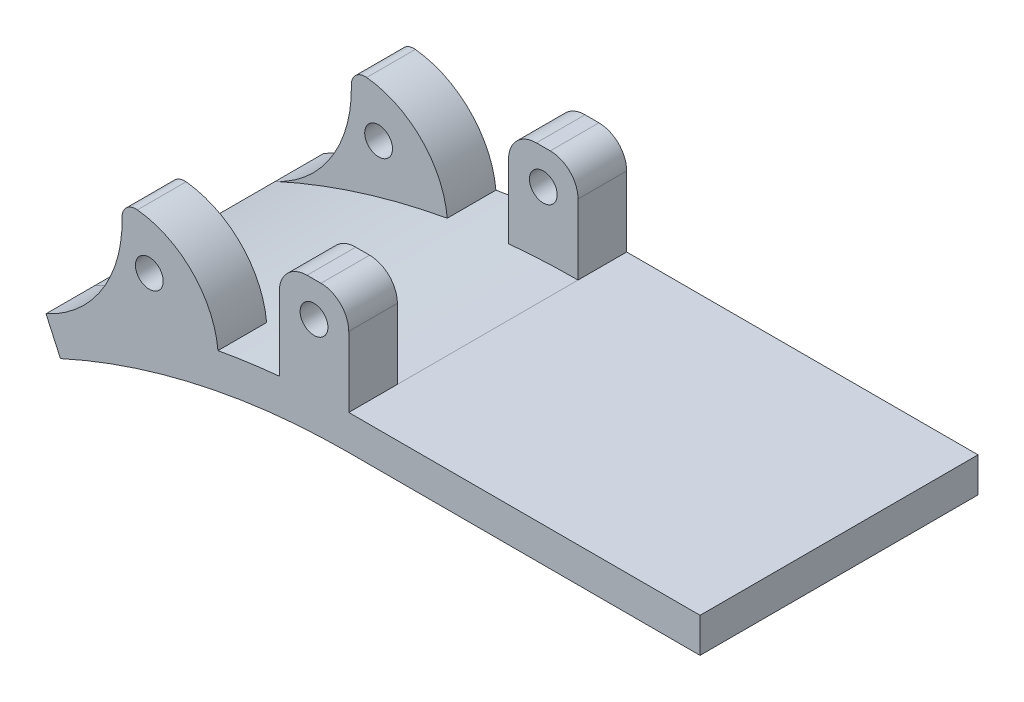
from build123d import *

# Parameters (mm, degrees)
BOSS_EXTRUDE1_DEPTH     = 38
BOSS_EXTRUDE2_START     = 1
BOSS_EXTRUDE2_DEPTH     = 1
SKETCH5_R               = 1.5
BOSS_EXTRUDE4_DEPTH     = 2
CUT_EXTRUDE1_REACH      = 109.923
CUT_EXTRUDE1_END_RADIUS = 5
SKETCH6_W               = 4
SKETCH6_H               = 25
SKETCH7_W               = 12
SKETCH7_H               = 7
CUT_EXTRUDE2_DEPTH      = 4.870537
SKETCH8_W               = 14
SKETCH8_H               = 8
SKETCH8_W_2             = 7
SKETCH8_H_2             = 2
BOSS_EXTRUDE5_DEPTH     = 1
CUT_EXTRUDE3_REACH      = 112.064
BOSS_EXTRUDE6_REACH     = 114.27
FILLET1_R               = 2
FILLET2_R               = 1.5
CUT_EXTRUDE4_START      = -1
CUT_EXTRUDE4_DEPTH      = 1
CUT_EXTRUDE5_DEPTH      = 114.605044241
CUT_EXTRUDE5_DEPTH_BACK = 114.605044241
CUT_EXTRUDE6_DEPTH      = 1
BOSS_EXTRUDE7_DEPTH     = 40
CUT_EXTRUDE7_DEPTH      = 114.952209619
BOSS_EXTRUDE8_START     = -7
SKETCH16_R              = 2
BOSS_EXTRUDE8_DEPTH     = 7
SKETCH17_R              = 2
BOSS_EXTRUDE9_DEPTH     = 7
SKETCH18_R              = 2
BOSS_EXTRUDE10_DEPTH    = 7
BOSS_EXTRUDE11_START    = -7
SKETCH19_R              = 2
BOSS_EXTRUDE11_DEPTH    = 7


with BuildPart() as part:
    # Sketch1 → Boss-Extrude1 (new body)
    with BuildSketch(Plane.XY):
        with BuildLine():
            ThreePointArc((94.07424068, -40.969403892), (98.52214239, -30.71978446), (94.053011164, -20.479403892))
            Line((94.053011164, -20.479403892), (42.671612541, -20.479403892))
            ThreePointArc((42.671612541, -20.479403892), (21.438645912, -22.763779795), (1.177500664, -29.512352859))
            ThreePointArc((1.177500664, -29.512352859), (-2.191079084, -36.245666757), (3.671612541, -40.969403889))
            Line((3.671612541, -40.969403889), (3.671612541, -39.969403889))
            ThreePointArc((3.671612541, -39.969403889), (-1.213963813, -36.032956279), (1.593185977, -30.421861364))
            ThreePointArc((1.593185977, -30.421861364), (21.65135639, -23.740895066), (42.671612541, -21.479403892))
            Line((42.671612541, -21.479403892), (93.651612541, -21.479403892))
            ThreePointArc((93.651612541, -21.479403892), (97.522142299, -30.720228087), (93.671612541, -39.969403889))
            Line((93.671612541, -39.969403889), (93.671612541, -40.969403892))
            Line((93.671612541, -40.969403892), (94.07424068, -40.969403892))
        make_face()
    extrude(amount=BOSS_EXTRUDE1_DEPTH)

    # Sketch2 → Boss-Extrude2 (add)
    with BuildSketch(Plane(origin=(0, 0, 0), x_dir=(-1, 0, 0), z_dir=(0, 0, -1)).offset(BOSS_EXTRUDE2_START)):
        with BuildLine():
            Line((-93.671612541, -40.969403892), (-3.671612541, -40.969403889))
            ThreePointArc((-3.671612541, -40.969403889), (2.191079084, -36.245666757), (-1.177500664, -29.512352859))
            ThreePointArc((-1.177500664, -29.512352859), (-21.438645912, -22.763779795), (-42.671612541, -20.479403892))
            Line((-42.671612541, -20.479403892), (-94.053011164, -20.479403892))
            ThreePointArc((-94.053011164, -20.479403892), (-98.52214239, -30.71978446), (-94.07424068, -40.969403892))
            Line((-94.07424068, -40.969403892), (-93.671612541, -40.969403892))
        make_face()
    boss_extrude2 = extrude(amount=-BOSS_EXTRUDE2_DEPTH)

    # Mirror1: Boss-Extrude2 across plane
    add(boss_extrude2.mirror(Plane.XY.offset(19)))

    # Sketch5 → Boss-Extrude4 (add)
    with BuildSketch(Plane.XZ.offset(21.479403892)):
        with Locations(Location((45.301612541, 27.89, 0), (0, 0, 270))):
            Circle(SKETCH5_R)
        with Locations(Location((45.301612541, 10.11, 0), (0, 0, 270))):
            Circle(SKETCH5_R)
        with Locations(Location((91.021612541, 27.89, 0), (0, 0, 270))):
            Circle(SKETCH5_R)
        with Locations(Location((91.021612541, 10.11, 0), (0, 0, 270))):
            Circle(SKETCH5_R)
    extrude(amount=BOSS_EXTRUDE4_DEPTH)

    # Cut-Extrude1: up to this cylinder (the profile starts outside it)
    cut_extrude1_end = Plane(origin=(3.671612541, -34.969403889, 19), z_dir=(0, 0, -1)) * Cylinder(CUT_EXTRUDE1_END_RADIUS, 230.846, mode=Mode.PRIVATE)
    # Sketch6 → Cut-Extrude1 (cut, up to the surface)
    with BuildSketch(Plane(origin=(0.000112733, -40.969403891, 0), x_dir=(1, 0, 0), z_dir=(0, -1, 0)), mode=Mode.PRIVATE) as cut_extrude1_sk1:
        with Locations((1.671499809, 19)):
            Rectangle(SKETCH6_W, SKETCH6_H)
    cut_extrude1_tool1 = extrude(cut_extrude1_sk1.sketch, amount=-CUT_EXTRUDE1_REACH, mode=Mode.PRIVATE) - cut_extrude1_end
    add(cut_extrude1_tool1.solids().sort_by_distance((1.671613, -40.969404, 19))[0], mode=Mode.SUBTRACT)

    # Sketch7 → Cut-Extrude2 (cut)
    with BuildSketch(Plane(origin=(98.522149904, 0, 0), x_dir=(0, 0, -1), z_dir=(1, 0, 0))):
        with Locations((-19, -23.979403892)):
            Rectangle(SKETCH7_W, SKETCH7_H)
    extrude(amount=-CUT_EXTRUDE2_DEPTH, mode=Mode.SUBTRACT)

    # Sketch8 → Boss-Extrude5 (add)
    with BuildSketch(Plane(origin=(93.651612541, 0, 0), x_dir=(0, 0, -1), z_dir=(1, 0, 0))):
        with Locations((-19, -24.479403892)):
            Rectangle(SKETCH8_W, SKETCH8_H)
        with Locations((-19, -24.179403892)):
            Rectangle(SKETCH8_W_2, SKETCH8_H_2, mode=Mode.SUBTRACT)
    extrude(amount=BOSS_EXTRUDE5_DEPTH)

    # Sketch9 → Cut-Extrude3 (cut, up to next)
    with BuildSketch(Plane.XY.offset(26), mode=Mode.PRIVATE) as cut_extrude3_sk1:
        with BuildLine():
            Line((94.651612541, -21.070233304), (94.651612541, -20.479403892))
            Line((94.651612541, -20.479403892), (94.053011164, -20.479403892))
            ThreePointArc((94.053011164, -20.479403892), (94.356749733, -20.770322341), (94.651612541, -21.070233304))
        make_face()
    cut_extrude3_tool1 = extrude(cut_extrude3_sk1.sketch, amount=-CUT_EXTRUDE3_REACH, mode=Mode.PRIVATE) & part.part
    add(cut_extrude3_tool1.solids().sort_by_distance((94.454082, -20.674371, 26))[0], mode=Mode.SUBTRACT)

    # Sketch10 → Boss-Extrude6 (add, up to next)
    with BuildSketch(Plane(origin=(94.651612541, 0, 0), x_dir=(0, 0, -1), z_dir=(1, 0, 0)), mode=Mode.PRIVATE) as boss_extrude6_sk1:
        Polygon((-26, -22.586039205), (-26, -28.479403892), (-12, -28.479403892), (-12, -22.586039205), (-13, -22.586039205), (-13, -27.479403892), (-25, -27.479403892), (-25, -22.586039205), align=None)
    boss_extrude6_tool1 = extrude(boss_extrude6_sk1.sketch, amount=BOSS_EXTRUDE6_REACH, mode=Mode.PRIVATE) - part.part
    add(boss_extrude6_tool1.solids().sort_by_distance((94.651613, -25.532722, 25.848101))[0])

    # Fillet1
    # the kernel refuses this fillet: 2 mm, written as the material it takes off along each edge
    with BuildSketch(Plane(origin=(94.053011164, -20.479403892, -3.217701096), x_dir=(-1, 0, 0), z_dir=(0, 0, 1))) as fillet1_piece_1:
        with BuildLine():
            CenterArc((0.8212769, 2), FILLET1_R, 223.46466941, 46.53533059)
            ThreePointArc((-0.630320494, 0.624185693), (-0.320105264, 0.307099227), (0, 0))
            Line((0, 0), (0.8212769, 0))
        make_face()
    extrude(amount=44.435402191, mode=Mode.SUBTRACT)

    # Fillet2
    # the kernel refuses this fillet: 1.5 mm, written as the material it takes off along each edge
    with BuildSketch(Plane(origin=(93.651612541, -28.479403892, 8.25), x_dir=(1, 0, 0), z_dir=(0, 0, 1))) as fillet2_piece_1:
        with BuildLine():
            CenterArc((FILLET2_R, FILLET2_R), FILLET2_R, 180, 90)
            Line((0, FILLET2_R), (0, 0))
            Line((0, 0), (FILLET2_R, 0))
        make_face()
    extrude(amount=21.5, mode=Mode.SUBTRACT)
    with BuildSketch(Plane(origin=(94.651612541, -21.070877825, 25), x_dir=(-0.9302888810599873, 0.3668277494630918, 0), z_dir=(0, 0, -1))) as fillet2_piece_2:
        with BuildLine():
            CenterArc((1.062160749, -1.395433322), FILLET2_R, 68.479891106, 90)
            Line((-0.333272572, -0.845191697), (-0.472815904, -0.790167535))
            Line((-0.472815904, -0.790167535), (-0.139543332, 0.055024162))
            Line((-0.139543332, 0.055024162), (-0.060315789, 0.137339017))
            ThreePointArc((-0.060315789, 0.137339017), (1.592890188, 0.168934204), (1.667426536, 0.139543332))
            Line((1.667426536, 0.139543332), (1.612402374, 0))
        make_face()
    extrude(amount=12, mode=Mode.SUBTRACT)

    # Sketch11 → Cut-Extrude4 (cut)
    with BuildSketch(Plane.XY.offset(39).offset(CUT_EXTRUDE4_START)):
        with BuildLine():
            Line((94.07424068, -40.969403892), (94.07424068, -27.479403892))
            Line((94.07424068, -27.479403892), (42.671612541, -27.479403892))
            ThreePointArc((42.671612541, -27.479403892), (20.062639565, -30.27500623), (-1.184449421, -38.493416121))
            ThreePointArc((-1.184449421, -38.493416121), (0.946183529, -40.314685612), (3.671612541, -40.969403889))
            Line((3.671612541, -40.969403889), (94.07424068, -40.969403892))
        make_face()
    extrude(amount=CUT_EXTRUDE4_DEPTH, mode=Mode.SUBTRACT)

    # Sketch12 → Cut-Extrude5 (cut, two sides: drawn at the far end of the back side and taken through both)
    with BuildSketch(Plane.XY.offset(38).offset(-CUT_EXTRUDE5_DEPTH_BACK)):
        with BuildLine():
            Line((0.671612541, -40.165556311), (0.671612541, -38.969403889))
            ThreePointArc((0.671612541, -38.969403889), (2.090473711, -39.712820379), (3.671612541, -39.969403889))
            Line((3.671612541, -39.969403889), (3.671612541, -40.969403889))
            ThreePointArc((3.671612541, -40.969403889), (2.118698271, -40.764958846), (0.671612541, -40.165556311))
        make_face()
    extrude(amount=CUT_EXTRUDE5_DEPTH + CUT_EXTRUDE5_DEPTH_BACK, mode=Mode.SUBTRACT)

    # Sketch13 → Cut-Extrude6 (cut)
    with BuildSketch(Plane(origin=(0, 0, -1), x_dir=(-1, 0, 0), z_dir=(0, 0, -1))):
        with BuildLine():
            Line((-94.07424068, -27.479403892), (-94.07424068, -40.969403892))
            Line((-94.07424068, -40.969403892), (-3.671612541, -40.969403889))
            Line((-3.671612541, -40.969403889), (-3.671612541, -39.969403889))
            ThreePointArc((-3.671612541, -39.969403889), (-2.090473711, -39.712820379), (-0.671612541, -38.969403889))
            Line((-0.671612541, -38.969403889), (-0.671612541, -40.165556311))
            ThreePointArc((-0.671612541, -40.165556311), (0.344410441, -39.427156619), (1.184449421, -38.493416121))
            ThreePointArc((1.184449421, -38.493416121), (-20.062639565, -30.27500623), (-42.671612541, -27.479403892))
            Line((-42.671612541, -27.479403892), (-94.07424068, -27.479403892))
        make_face()
    extrude(amount=-CUT_EXTRUDE6_DEPTH, mode=Mode.SUBTRACT)

    # Sketch14 → Boss-Extrude7 (add, through all)
    with BuildSketch(Plane.XY.offset(39)):
        with BuildLine():
            Line((42.671612541, -20.479403892), (93.231734264, -20.479403892))
            Line((93.231734264, -20.479403892), (93.231734264, -15.479403892))
            Line((93.231734264, -15.479403892), (42.671612541, -15.479403892))
            ThreePointArc((42.671612541, -15.479403892), (20.375093521, -17.878203441), (-0.9009259, -24.964810334))
            Line((-0.9009259, -24.964810334), (1.177500664, -29.512352859))
            ThreePointArc((1.177500664, -29.512352859), (21.438645912, -22.763779795), (42.671612541, -20.479403892))
        make_face()
    extrude(amount=-BOSS_EXTRUDE7_DEPTH)

    # Sketch15 → Cut-Extrude7 (cut, through all)
    with BuildSketch(Plane.XY.offset(39)):
        with BuildLine():
            Line((93.231734264, -20.479403892), (113.754694227, -15.939324801))
            Line((113.754694227, -15.939324801), (103.493214246, -63.655688178))
            Line((103.493214246, -63.655688178), (-19.85580102, -63.655688178))
            Line((-19.85580102, -63.655688178), (-16.285239541, -25.988091954))
            Line((-16.285239541, -25.988091954), (1.177500664, -29.512352859))
            ThreePointArc((1.177500664, -29.512352859), (21.438645912, -22.763779795), (42.671612541, -20.479403892))
            Line((42.671612541, -20.479403892), (93.231734264, -20.479403892))
        make_face()
    extrude(amount=-CUT_EXTRUDE7_DEPTH, mode=Mode.SUBTRACT)

    # Sketch16 → Boss-Extrude8 (add)
    with BuildSketch(Plane(origin=(0, 0, -1), x_dir=(-1, 0, 0), z_dir=(0, 0, -1)).offset(BOSS_EXTRUDE8_START)):
        with BuildLine():
            ThreePointArc((0.9009259, -24.964810334), (-11.231615785, -20.305562163), (-23.847476831, -17.18350974))
            ThreePointArc((-23.847476831, -17.18350974), (-20.15199056, -9.237296242), (-12.254952675, -5.437859392))
            ThreePointArc((-12.254952675, -5.437859392), (-10.689930256, -5.956372475), (-10.046089467, -7.474140583))
            ThreePointArc((-10.046089467, -7.474140583), (-7.195975116, -17.861398125), (0.9009259, -24.964810334))
        make_face()
        with Locations((-13.96627469, -12.479403892)):
            Circle(SKETCH16_R, mode=Mode.SUBTRACT)
    extrude(amount=BOSS_EXTRUDE8_DEPTH)

    # Sketch17 → Boss-Extrude9 (add)
    with BuildSketch(Plane.XY.offset(39)):
        with BuildLine():
            ThreePointArc((-0.9009259, -24.964810334), (7.195975116, -17.861398125), (10.046089467, -7.474140583))
            ThreePointArc((10.046089467, -7.474140583), (10.689930256, -5.956372475), (12.254952675, -5.437859392))
            ThreePointArc((12.254952675, -5.437859392), (20.15199056, -9.237296242), (23.847476831, -17.18350974))
            ThreePointArc((23.847476831, -17.18350974), (11.231615785, -20.305562163), (-0.9009259, -24.964810334))
        make_face()
        with Locations(Location((13.96627469, -12.479403892, 0), (0, 0, 180))):
            Circle(SKETCH17_R, mode=Mode.SUBTRACT)
    extrude(amount=-BOSS_EXTRUDE9_DEPTH)

    # Sketch18 → Boss-Extrude10 (add)
    with BuildSketch(Plane.XY.offset(39)):
        with BuildLine():
            Line((42.671612541, -15.479403892), (42.671612541, -5.376783048))
            ThreePointArc((42.671612541, -5.376783048), (41.500039666, -2.548355923), (38.671612541, -1.376783048))
            Line((38.671612541, -1.376783048), (36.671612541, -1.376783048))
            ThreePointArc((36.671612541, -1.376783048), (33.843185417, -2.548355923), (32.671612541, -5.376783048))
            Line((32.671612541, -5.376783048), (32.671612541, -15.95749798))
            ThreePointArc((32.671612541, -15.95749798), (37.665901454, -15.598995636), (42.671612541, -15.479403892))
        make_face()
        with Locations((37.671612541, -6.376783048)):
            Circle(SKETCH18_R, mode=Mode.SUBTRACT)
    extrude(amount=-BOSS_EXTRUDE10_DEPTH)

    # Sketch19 → Boss-Extrude11 (add)
    with BuildSketch(Plane(origin=(0, 0, -1), x_dir=(-1, 0, 0), z_dir=(0, 0, -1)).offset(BOSS_EXTRUDE11_START)):
        with BuildLine():
            Line((-32.671612541, -15.95749798), (-32.671612541, -5.376783048))
            ThreePointArc((-32.671612541, -5.376783048), (-33.843185417, -2.548355923), (-36.671612541, -1.376783048))
            Line((-36.671612541, -1.376783048), (-38.671612541, -1.376783048))
            ThreePointArc((-38.671612541, -1.376783048), (-41.500039666, -2.548355923), (-42.671612541, -5.376783048))
            Line((-42.671612541, -5.376783048), (-42.671612541, -15.479403892))
            ThreePointArc((-42.671612541, -15.479403892), (-37.665901454, -15.598995636), (-32.671612541, -15.95749798))
        make_face()
        with Locations(Location((-37.671612541, -6.376783048, 0), (0, 0, 180))):
            Circle(SKETCH19_R, mode=Mode.SUBTRACT)
    extrude(amount=BOSS_EXTRUDE11_DEPTH)


solid = part.part
